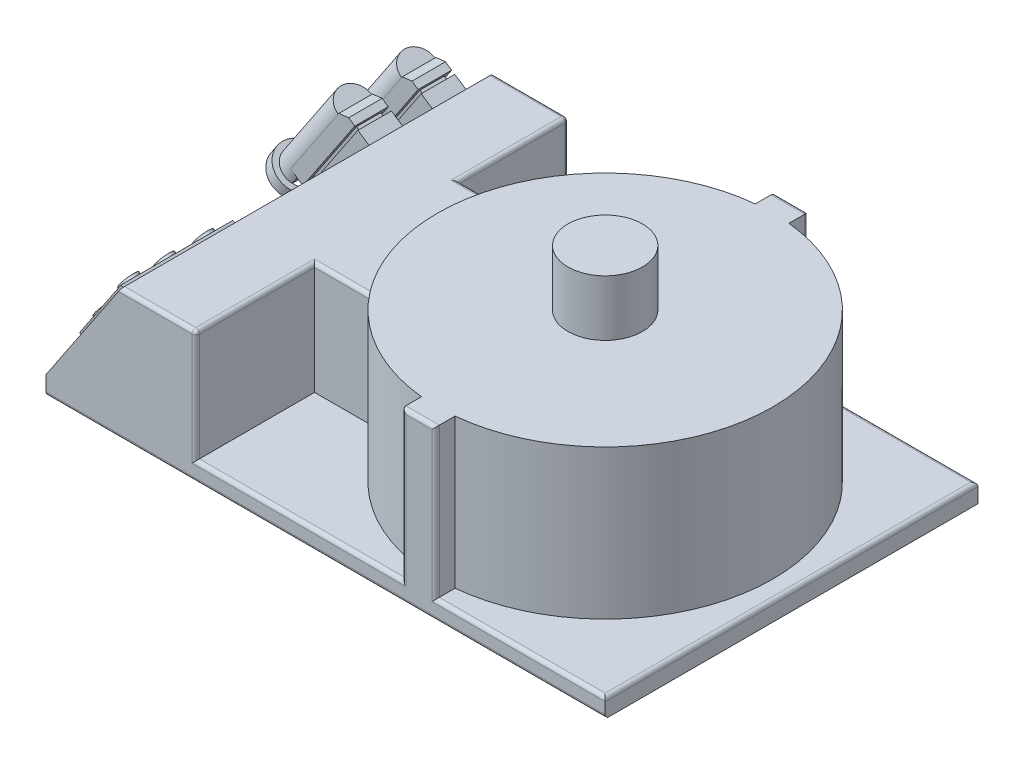
from build123d import *
from build123d.topology import SkipClean

# Parameters (mm, degrees)
SKETCH1_W             = 150
SKETCH1_H             = 100
BOSS_EXTRUDE1_DEPTH   = 5
SKETCH2_R             = 45
BOSS_EXTRUDE2_DEPTH   = 40
SKETCH4_R             = 10
BOSS_EXTRUDE3_DEPTH   = 15
SKETCH5_W             = 9
SKETCH5_H             = 100
BOSS_EXTRUDE5_DEPTH   = 40
SKETCH6_W             = 80.317123649
SKETCH6_H             = 100
BOSS_EXTRUDE8_DEPTH   = 30
CUT_EXTRUDE2_START    = -30
CUT_EXTRUDE2_DEPTH    = 30
CUT_EXTRUDE3_DEPTH    = 111
SKETCH11_W            = 20
SKETCH11_H            = 30
BOSS_EXTRUDE9_DEPTH   = 1
SKETCH12_R            = 2.5
BOSS_EXTRUDE10_DEPTH  = 1
SKETCH13_W            = 25
SKETCH13_H            = 9
BOSS_EXTRUDE11_DEPTH  = 4
SKETCH14_W            = 22.246843074
SKETCH14_H            = 6.498718574
BOSS_EXTRUDE12_DEPTH  = 1
SKETCH15_W            = 25
SKETCH15_H            = 9
BOSS_EXTRUDE13_DEPTH  = 4
CUT_EXTRUDE4_DEPTH    = 13
BOSS_EXTRUDE14_DEPTH  = 23
BOSS_EXTRUDE15_START  = 3
BOSS_EXTRUDE15_DEPTH  = 3
SKETCH19_R            = 6
SKETCH19_R_2          = 4.5
BOSS_EXTRUDE16_DEPTH  = 3
MIRROR3_START         = -32.616927235
MIRROR3_OUTLINE_W     = 4
MIRROR3_OUTLINE_H     = 9
MIRROR3_DEPTH         = 23
MIRROR3_START_2       = -31.240348772
MIRROR3_2_DEPTH       = 22.246843074
MIRROR3_START_3       = -35.616927235
MIRROR3_3_DEPTH       = 3
MIRROR3_START_4       = -8.993505698
MIRROR3_4_OUTLINE_W   = 4
MIRROR3_4_OUTLINE_H   = 9
MIRROR3_4_DEPTH       = 1.376578463
MIRROR3_START_5       = -41
MIRROR3_5_OUTLINE_W   = 2.608428667
MIRROR3_5_OUTLINE_H   = 9
MIRROR3_5_DEPTH       = 2.335246434
SKETCH20_R            = 6
SKETCH20_R_2          = 4.5
BOSS_EXTRUDE17_DEPTH  = 3
FILLET1_R             = 1
FILLET2_R             = 1
BODY_MOVE_COPY1_ANGLE = 90


with BuildPart() as part:
    # Sketch1 → Boss-Extrude1 (new body)
    with BuildSketch(Plane.XY):
        Rectangle(SKETCH1_W, SKETCH1_H)
    extrude(amount=BOSS_EXTRUDE1_DEPTH)

    # Sketch2 → Boss-Extrude2 (add)
    with BuildSketch(Plane(origin=(0, 0, 0), x_dir=(-1, 0, 0), z_dir=(0, 0, -1))):
        with Locations(Location((-25, 0, 0), (0, 0, 180))):
            Circle(SKETCH2_R)
    extrude(amount=BOSS_EXTRUDE2_DEPTH)

    # Sketch4 → Boss-Extrude3 (add)
    with BuildSketch(Plane(origin=(0, 0, -40), x_dir=(-1, 0, 0), z_dir=(0, 0, -1))):
        with Locations((-25, 0)):
            Circle(SKETCH4_R)
    extrude(amount=BOSS_EXTRUDE3_DEPTH)

    # Sketch5 → Boss-Extrude5 (add)
    with BuildSketch(Plane(origin=(0, 0, -40), x_dir=(-1, 0, 0), z_dir=(0, 0, -1))):
        with Locations((-25, 0)):
            Rectangle(SKETCH5_W, SKETCH5_H)
    extrude(amount=-BOSS_EXTRUDE5_DEPTH)

    # Sketch6 → Boss-Extrude8 (add)
    with BuildSketch(Plane(origin=(0, 0, 0), x_dir=(-1, 0, 0), z_dir=(0, 0, -1))):
        with Locations((34.841438176, 0)):
            Rectangle(SKETCH6_W, SKETCH6_H)
    extrude(amount=BOSS_EXTRUDE8_DEPTH)

    # Sketch8 → Cut-Extrude2 (cut)
    with SkipClean():  # the faces are left unmerged after this step: merging them gives an invalid solid
        with BuildSketch(Plane(origin=(0, 0, -30), x_dir=(-1, 0, 0), z_dir=(0, 0, -1)).offset(CUT_EXTRUDE2_START)):
            with BuildLine():
                Line((34.841438175, -50), (34.841438175, -20.46057611))
                Line((34.841438175, -20.46057611), (15.07948135, -20.46057611))
                ThreePointArc((15.07948135, -20.46057611), (6.511107186, -32.125536944), (-5.317123649, -40.467077712))
                Line((-5.317123649, -40.467077712), (-5.317123649, -50))
                Line((-5.317123649, -50), (34.841438175, -50))
            make_face()
            with BuildLine():
                Line((-5.317123649, 50), (-5.317123649, 40.467077712))
                ThreePointArc((-5.317123649, 40.467077712), (7.422035496, 31.205954789), (16.189622203, 18.122224554))
                Line((16.189622203, 18.122224554), (34.841438175, 18.122224554))
                Line((34.841438175, 18.122224554), (34.841438175, 50))
                Line((34.841438175, 50), (-5.317123649, 50))
            make_face()
        extrude(amount=CUT_EXTRUDE2_DEPTH, mode=Mode.SUBTRACT)

    # Sketch9 → Cut-Extrude3 (cut)
    with SkipClean():  # the faces are left unmerged after this step: merging them gives an invalid solid
        with BuildSketch(Plane.XZ.offset(50)):
            Polygon((-75, 0), (-54.920719088, -30), (-75, -30), align=None)
        extrude(amount=-CUT_EXTRUDE3_DEPTH, mode=Mode.SUBTRACT)

    # Sketch11 → Boss-Extrude9 (add)
    with SkipClean():  # the faces are left unmerged after this step: merging them gives an invalid solid
        with BuildSketch(Plane(origin=(-51.796473514, 0, -34.667864732), x_dir=(-0.5562196986319989, 0, 0.8310352861664349), z_dir=(-0.8310352861664349, 0, -0.5562196986319989))):
            with Locations((17.616927235, 33)):
                Rectangle(SKETCH11_W, SKETCH11_H)
        extrude(amount=BOSS_EXTRUDE9_DEPTH)

    # Sketch12 → Boss-Extrude10 (add)
    with SkipClean():  # the faces are left unmerged after this step: merging them gives an invalid solid
        with BuildSketch(Plane(origin=(-52.6275088, 0, -35.22408443), x_dir=(-0.5562196986319992, 0, 0.8310352861664349), z_dir=(-0.8310352861664349, 0, -0.5562196986319992))):
            with Locations((11.616927235, 23)):
                Circle(SKETCH12_R)
            with Locations((11.616927235, 33.468721453)):
                Circle(SKETCH12_R)
            with Locations((11.616927235, 43)):
                Circle(SKETCH12_R)
            with Locations((23.616927235, 23)):
                Circle(SKETCH12_R)
            with Locations((23.616927235, 33.468721453)):
                Circle(SKETCH12_R)
            with Locations((23.616927235, 43)):
                Circle(SKETCH12_R)
        extrude(amount=BOSS_EXTRUDE10_DEPTH)

    # Sketch13 → Boss-Extrude11 (add)
    with SkipClean():  # the faces are left unmerged after this step: merging them gives an invalid solid
        with BuildSketch(Plane(origin=(-51.796473514, 0, -34.667864732), x_dir=(-0.5562196986319989, 0, 0.8310352861664349), z_dir=(-0.8310352861664349, 0, -0.5562196986319989))):
            with Locations((20.116927235, -39.513259665)):
                Rectangle(SKETCH13_W, SKETCH13_H)
        extrude(amount=BOSS_EXTRUDE11_DEPTH)

    # Sketch14 → Boss-Extrude12 (add)
    with SkipClean():  # the faces are left unmerged after this step: merging them gives an invalid solid
        with BuildSketch(Plane(origin=(-55.120614659, 0, -36.892743526), x_dir=(-0.556219698631999, 0, 0.8310352861664349), z_dir=(-0.8310352861664349, 0, -0.556219698631999))):
            with Locations((20.116927235, -39.513259665)):
                Rectangle(SKETCH14_W, SKETCH14_H)
        extrude(amount=BOSS_EXTRUDE12_DEPTH)

    # Sketch15 → Boss-Extrude13 (add)
    with SkipClean():  # the faces are left unmerged after this step: merging them gives an invalid solid
        with BuildSketch(Plane(origin=(-55.951649945, 0, -37.448963225), x_dir=(-0.5562196986319986, 0, 0.8310352861664351), z_dir=(-0.8310352861664351, 0, -0.5562196986319986))):
            with Locations((20.116927235, -39.513259665)):
                Rectangle(SKETCH15_W, SKETCH15_H)
        extrude(amount=BOSS_EXTRUDE13_DEPTH)

    # Sketch16 → Cut-Extrude4 (cut)
    with SkipClean():  # the faces are left unmerged after this step: merging them gives an invalid solid
        with BuildSketch(Plane.XZ.offset(44.013259665)):
            Polygon((-61.850405488, -32.231467318), (-64.443857619, -31.95235057), (-63.51247606, -33.343906715), align=None)
        extrude(amount=-CUT_EXTRUDE4_DEPTH, mode=Mode.SUBTRACT)

    # Sketch17 → Boss-Extrude14 (add)
    with SkipClean():  # the faces are left unmerged after this step: merging them gives an invalid solid
        with BuildSketch(Plane(origin=(-18.142177437, 0, 27.105817458), x_dir=(0.8310352861664351, 0, 0.5562196986319986), z_dir=(-0.5562196986319986, 0, 0.8310352861664351))):
            with BuildLine():
                Line((-69.327646462, -35.482130791), (-69.327646462, -43.544388539))
                ThreePointArc((-69.327646462, -43.544388539), (-75.827646462, -39.513259665), (-69.327646462, -35.482130791))
            make_face()
        extrude(amount=-BOSS_EXTRUDE14_DEPTH)

    # Sketch18 → Boss-Extrude15 (add)
    with SkipClean():  # the faces are left unmerged after this step: merging them gives an invalid solid
        with BuildSketch(Plane(origin=(-18.142177437, 0, 27.105817458), x_dir=(0.8310352861664351, 0, 0.5562196986319986), z_dir=(-0.5562196986319986, 0, 0.8310352861664351)).offset(BOSS_EXTRUDE15_START)):
            with BuildLine():
                Line((-69.327646462, -35.482130791), (-69.327646462, -43.544388539))
                ThreePointArc((-69.327646462, -43.544388539), (-75.827646462, -39.513259665), (-69.327646462, -35.482130791))
            make_face()
        extrude(amount=-BOSS_EXTRUDE15_DEPTH)

    # Mirror3: read off the stored shape, not the designer's step
    # Mirror3 outline → Mirror3 (add)
    with SkipClean():  # the faces are left unmerged after this step: merging them gives an invalid solid
        with BuildSketch(Plane(origin=(0, 0, 0), x_dir=(0.8310352861664349, 0, 0.5562196986319992), z_dir=(0.556219698631999, 0, -0.831035286166435)).offset(MIRROR3_START)):
            with BuildLine():
                Line((-67.327646462, 27.013259665), (-71.327646462, 27.013259665))
                ThreePointArc((-71.327646462, 27.013259665), (-75.827646462, 22.513259665), (-71.327646462, 18.013259665))
                Line((-71.327646462, 18.013259665), (-67.327646462, 18.013259665))
                Line((-67.327646462, 18.013259665), (-67.327646462, 27.013259665))
            make_face()
            with Locations((-64.327646462, 22.513259665)):
                Rectangle(MIRROR3_OUTLINE_W, MIRROR3_OUTLINE_H)
        extrude(amount=MIRROR3_DEPTH)

    # Mirror3 2 outline → Mirror3 2 (add)
    with SkipClean():  # the faces are left unmerged after this step: merging them gives an invalid solid
        with BuildSketch(Plane(origin=(0, 0, 0), x_dir=(0.8310352861664349, 0, 0.5562196986319992), z_dir=(0.556219698631999, 0, -0.831035286166435)).offset(MIRROR3_START_2)):
            Polygon((-71.327646462, 27.013259665), (-71.327646462, 18.013259665), (-67.327646462, 18.013259665), (-67.327646462, 19.263900378), (-66.327646462, 19.263900378), (-66.327646462, 18.013259665), (-62.327646462, 18.013259665), (-62.327646462, 27.013259665), (-66.327646462, 27.013259665), (-66.327646462, 25.762618952), (-67.327646462, 25.762618952), (-67.327646462, 27.013259665), align=None)
        extrude(amount=MIRROR3_2_DEPTH)

    # Mirror3 3 outline → Mirror3 3 (add)
    with SkipClean():  # the faces are left unmerged after this step: merging them gives an invalid solid
        with BuildSketch(Plane(origin=(0, 0, 0), x_dir=(0.8310352861664349, 0, 0.5562196986319992), z_dir=(0.556219698631999, 0, -0.831035286166435)).offset(MIRROR3_START_3)):
            with BuildLine():
                ThreePointArc((-69.327646462, 26.544388539), (-75.827646462, 22.513259665), (-69.327646462, 18.482130791))
                Line((-69.327646462, 18.482130791), (-69.327646462, 26.544388539))
            make_face()
        extrude(amount=MIRROR3_3_DEPTH)

    # Mirror3 4 outline → Mirror3 4 (add)
    with SkipClean():  # the faces are left unmerged after this step: merging them gives an invalid solid
        with BuildSketch(Plane(origin=(0, 0, 0), x_dir=(0.8310352861664349, 0, 0.5562196986319992), z_dir=(0.556219698631999, 0, -0.831035286166435)).offset(MIRROR3_START_4)):
            with Locations((-69.327646462, 22.513259665)):
                Rectangle(MIRROR3_4_OUTLINE_W, MIRROR3_4_OUTLINE_H)
            with Locations((-64.327646462, 22.513259665)):
                Rectangle(MIRROR3_4_OUTLINE_W, MIRROR3_4_OUTLINE_H)
        extrude(amount=MIRROR3_4_DEPTH)

    # Mirror3 5 outline → Mirror3 5 (cut)
    with SkipClean():  # the faces are left unmerged after this step: merging them gives an invalid solid
        with BuildSketch(Plane(origin=(0, 0, 0), x_dir=(0.9942584066298962, 0, -0.10700570473474803), z_dir=(0.10700570473474803, 0, 0.9942584066298962)).offset(MIRROR3_START_5)):
            with Locations((-59.350549069, -22.513259665)):
                Rectangle(MIRROR3_5_OUTLINE_W, MIRROR3_5_OUTLINE_H)
        extrude(amount=MIRROR3_5_DEPTH, mode=Mode.SUBTRACT)

    # Fillet1
    # the kernel refuses this fillet: 1 mm, written as the material it takes off along each edge
    with BuildSketch(Plane(origin=(-35.841438175, -49, -29), x_dir=(1, 0, 0), z_dir=(0, 0, -1))) as fillet1_piece_1_section:
        Polygon((0, 0), (FILLET1_R, 0), (FILLET1_R, FILLET1_R), (0, FILLET1_R), align=None)
    fillet1_piece_1 = extrude(amount=FILLET1_R, mode=Mode.PRIVATE)
    fillet1_piece_1 = fillet1_piece_1 - Plane(origin=(-35.841438175, -49, -29), x_dir=(-0.7071067811865475, 0.7071067811865475, 0), z_dir=(0, 0, -1)) * Sphere(FILLET1_R, mode=Mode.PRIVATE)
    add(fillet1_piece_1, mode=Mode.SUBTRACT)
    with BuildSketch(Plane(origin=(77.5, -50, 0), x_dir=(0, 0, 1), z_dir=(-1, 0, 0)), Plane(origin=(29.5, 50, 0), x_dir=(0, 0, 1), z_dir=(1, 0, 0))) as fillet1_piece_2:
        with BuildLine():
            CenterArc((FILLET1_R, FILLET1_R), FILLET1_R, 180, 90)
            Line((0, FILLET1_R), (0, 0))
            Line((0, 0), (FILLET1_R, 0))
        make_face()
    extrude(amount=48, mode=Mode.SUBTRACT)
    with BuildSketch(Plane(origin=(-34.841438175, 50, 0), x_dir=(0, 0, 1), z_dir=(1, 0, 0)), Plane(origin=(5.317123649, -50, 0), x_dir=(0, 0, 1), z_dir=(-1, 0, 0))) as fillet1_piece_3:
        with BuildLine():
            CenterArc((FILLET1_R, FILLET1_R), FILLET1_R, 180, 90)
            Line((0, FILLET1_R), (0, 0))
            Line((0, 0), (FILLET1_R, 0))
        make_face()
    extrude(amount=40.158561825, mode=Mode.SUBTRACT)
    with BuildSketch(Plane(origin=(20.5, 50, -42.5), x_dir=(1, 0, 0), z_dir=(0, 0, 1)), Plane(origin=(29.5, -50, -42.5), x_dir=(-1, 0, 0), z_dir=(0, 0, 1))) as fillet1_piece_4:
        with BuildLine():
            CenterArc((FILLET1_R, -FILLET1_R), FILLET1_R, 90, 90)
            Line((0, -FILLET1_R), (0, 0))
            Line((0, 0), (FILLET1_R, 0))
        make_face()
    extrude(amount=42.5, mode=Mode.SUBTRACT)
    with BuildSketch(Plane(origin=(32, 50, -40), x_dir=(0, 0, 1), z_dir=(-1, 0, 0)), Plane(origin=(18, -50, -40), x_dir=(0, 0, 1), z_dir=(1, 0, 0))) as fillet1_piece_5:
        with BuildLine():
            CenterArc((FILLET1_R, -FILLET1_R), FILLET1_R, 90, 90)
            Line((0, -FILLET1_R), (0, 0))
            Line((0, 0), (FILLET1_R, 0))
        make_face()
    extrude(amount=14, mode=Mode.SUBTRACT)
    with BuildSketch(Plane(origin=(20.5, -50, -42.5), x_dir=(1, 0, 0), z_dir=(0, 0, 1)), Plane(origin=(29.5, 50, -42.5), x_dir=(-1, 0, 0), z_dir=(0, 0, 1))) as fillet1_piece_6:
        with BuildLine():
            CenterArc((FILLET1_R, FILLET1_R), FILLET1_R, 180, 90)
            Line((0, FILLET1_R), (0, 0))
            Line((0, 0), (FILLET1_R, 0))
        make_face()
    extrude(amount=42.5, mode=Mode.SUBTRACT)
    with BuildSketch(Plane(origin=(75, 52.5, 0), x_dir=(-1, 0, 0), z_dir=(0, -1, 0))) as fillet1_piece_7:
        with BuildLine():
            CenterArc((FILLET1_R, -FILLET1_R), FILLET1_R, 90, 90)
            Line((0, -FILLET1_R), (0, 0))
            Line((0, 0), (FILLET1_R, 0))
        make_face()
    extrude(amount=105, mode=Mode.SUBTRACT)
    with BuildSketch(Plane(origin=(-77.5, 50, 5), x_dir=(0, 0, -1), z_dir=(1, 0, 0))) as fillet1_piece_8:
        with BuildLine():
            CenterArc((FILLET1_R, -FILLET1_R), FILLET1_R, 90, 90)
            Line((0, -FILLET1_R), (0, 0))
            Line((0, 0), (FILLET1_R, 0))
        make_face()
    extrude(amount=155, mode=Mode.SUBTRACT)
    with BuildSketch(Plane(origin=(-57.420719088, -50, -30), x_dir=(0, 0, 1), z_dir=(1, 0, 0))) as fillet1_piece_9:
        with BuildLine():
            CenterArc((FILLET1_R, -FILLET1_R), FILLET1_R, 90, 90)
            Line((0, -FILLET1_R), (0, 0))
            Line((0, 0), (FILLET1_R, 0))
        make_face()
    extrude(amount=21.579280912, mode=Mode.SUBTRACT)
    with BuildSketch(Plane(origin=(-34.841438175, -50, 0), x_dir=(-1, 0, 0), z_dir=(0, 0, -1))) as fillet1_piece_10:
        with BuildLine():
            CenterArc((FILLET1_R, FILLET1_R), FILLET1_R, 180, 90)
            Line((0, FILLET1_R), (0, 0))
            Line((0, 0), (FILLET1_R, 0))
        make_face()
    extrude(amount=29, mode=Mode.SUBTRACT)
    with BuildSketch(Plane(origin=(-34.841438175, -49, -30), x_dir=(-1, 0, 0), z_dir=(0, 1, 0))) as fillet1_piece_11:
        with BuildLine():
            CenterArc((FILLET1_R, FILLET1_R), FILLET1_R, 180, 90)
            Line((0, FILLET1_R), (0, 0))
            Line((0, 0), (FILLET1_R, 0))
        make_face()
    extrude(amount=28.53942389, mode=Mode.SUBTRACT)
    with BuildSketch(Plane(origin=(-34.841438175, -20.46057611, -30), x_dir=(0, 1, 0), z_dir=(1, 0, 0))) as fillet1_piece_12_section:
        with BuildLine():
            CenterArc((FILLET1_R, FILLET1_R), FILLET1_R, 180, 90)
            Line((0, FILLET1_R), (0, 0))
            Line((0, 0), (FILLET1_R, 0))
        make_face()
    fillet1_piece_12 = extrude(amount=22.261956826, mode=Mode.PRIVATE)
    fillet1_piece_12 = fillet1_piece_12 - Plane(origin=(25, 0, -30), x_dir=(1, 0, 0), z_dir=(0, 0, 1)) * Cylinder(45, 49, mode=Mode.PRIVATE)
    add(fillet1_piece_12, mode=Mode.SUBTRACT)
    with BuildSketch(Plane(origin=(-13.689622203, 18.122224554, -30), x_dir=(0, -1, 0), z_dir=(-1, 0, 0))) as fillet1_piece_13_section:
        with BuildLine():
            CenterArc((FILLET1_R, FILLET1_R), FILLET1_R, 180, 90)
            Line((0, FILLET1_R), (0, 0))
            Line((0, 0), (FILLET1_R, 0))
        make_face()
    fillet1_piece_13 = extrude(amount=21.151815973, mode=Mode.PRIVATE)
    fillet1_piece_13 = fillet1_piece_13 - Plane(origin=(25, 0, -30), x_dir=(1, 0, 0), z_dir=(0, 0, 1)) * Cylinder(45, 47, mode=Mode.PRIVATE)
    add(fillet1_piece_13, mode=Mode.SUBTRACT)
    with BuildSketch(Plane(origin=(-34.841438175, 18.122224554, -30), x_dir=(-1, 0, 0), z_dir=(0, 1, 0))) as fillet1_piece_14:
        with BuildLine():
            CenterArc((FILLET1_R, FILLET1_R), FILLET1_R, 180, 90)
            Line((0, FILLET1_R), (0, 0))
            Line((0, 0), (FILLET1_R, 0))
        make_face()
    extrude(amount=34.377775446, mode=Mode.SUBTRACT)
    with BuildSketch(Plane(origin=(20.5, -50, 0), x_dir=(0, 0, 1), z_dir=(-1, 0, 0)), Plane(origin=(5.317123649, 50, 0), x_dir=(0, 0, 1), z_dir=(1, 0, 0))) as fillet1_piece_15:
        with BuildLine():
            CenterArc((FILLET1_R, FILLET1_R), FILLET1_R, 180, 90)
            Line((0, FILLET1_R), (0, 0))
            Line((0, 0), (FILLET1_R, 0))
        make_face()
    extrude(amount=15.182876351, mode=Mode.SUBTRACT)
    with BuildSketch(Plane(origin=(77.5, -50, 0), x_dir=(0, 0, 1), z_dir=(-1, 0, 0))) as fillet1_piece_16a_section:
        with BuildLine():
            CenterArc((FILLET1_R, FILLET1_R), FILLET1_R, 180, 90)
            Line((0, FILLET1_R), (0, 0))
            Line((0, 0), (FILLET1_R, 0))
        make_face()
    fillet1_piece_16a = extrude(amount=50.5, mode=Mode.PRIVATE)
    fillet1_piece_16a = split(fillet1_piece_16a, bisect_by=Plane(origin=(29.5, -50, 0), z_dir=(-1, 0, 0)), keep=Keep.TOP, mode=Mode.PRIVATE)
    with BuildSketch(Plane(origin=(29.5, -50, -42.5), x_dir=(-1, 0, 0), z_dir=(0, 0, 1))) as fillet1_piece_16b_section:
        with BuildLine():
            CenterArc((FILLET1_R, -FILLET1_R), FILLET1_R, 90, 90)
            Line((0, -FILLET1_R), (0, 0))
            Line((0, 0), (FILLET1_R, 0))
        make_face()
    fillet1_piece_16b = extrude(amount=45, mode=Mode.PRIVATE)
    fillet1_piece_16b = split(fillet1_piece_16b, bisect_by=Plane(origin=(29.5, -50, 0), z_dir=(0, 0, 1)), keep=Keep.TOP, mode=Mode.PRIVATE)
    fillet1_piece_16 = fillet1_piece_16a & fillet1_piece_16b
    add(fillet1_piece_16, mode=Mode.SUBTRACT)
    with BuildSketch(Plane(origin=(5.317123649, 50, 0), x_dir=(0, 0, 1), z_dir=(1, 0, 0))) as fillet1_piece_17a_section:
        with BuildLine():
            CenterArc((FILLET1_R, FILLET1_R), FILLET1_R, 180, 90)
            Line((0, FILLET1_R), (0, 0))
            Line((0, 0), (FILLET1_R, 0))
        make_face()
    fillet1_piece_17a = extrude(amount=17.682876351, mode=Mode.PRIVATE)
    fillet1_piece_17a = split(fillet1_piece_17a, bisect_by=Plane(origin=(20.5, 50, 0), z_dir=(1, 0, 0)), keep=Keep.TOP, mode=Mode.PRIVATE)
    with BuildSketch(Plane(origin=(20.5, 50, -42.5), x_dir=(1, 0, 0), z_dir=(0, 0, 1))) as fillet1_piece_17b_section:
        with BuildLine():
            CenterArc((FILLET1_R, -FILLET1_R), FILLET1_R, 90, 90)
            Line((0, -FILLET1_R), (0, 0))
            Line((0, 0), (FILLET1_R, 0))
        make_face()
    fillet1_piece_17b = extrude(amount=45, mode=Mode.PRIVATE)
    fillet1_piece_17b = split(fillet1_piece_17b, bisect_by=Plane(origin=(20.5, 50, 0), z_dir=(0, 0, 1)), keep=Keep.TOP, mode=Mode.PRIVATE)
    fillet1_piece_17 = fillet1_piece_17a & fillet1_piece_17b
    add(fillet1_piece_17, mode=Mode.SUBTRACT)
    with BuildSketch(Plane(origin=(20.5, -50, -42.5), x_dir=(1, 0, 0), z_dir=(0, 0, 1))) as fillet1_piece_18a_section:
        with BuildLine():
            CenterArc((FILLET1_R, FILLET1_R), FILLET1_R, 180, 90)
            Line((0, FILLET1_R), (0, 0))
            Line((0, 0), (FILLET1_R, 0))
        make_face()
    fillet1_piece_18a = extrude(amount=45, mode=Mode.PRIVATE)
    fillet1_piece_18a = split(fillet1_piece_18a, bisect_by=Plane(origin=(20.5, -50, 0), z_dir=(0, 0, 1)), keep=Keep.TOP, mode=Mode.PRIVATE)
    with BuildSketch(Plane(origin=(23, -50, 0), x_dir=(0, 0, 1), z_dir=(-1, 0, 0))) as fillet1_piece_18b_section:
        with BuildLine():
            CenterArc((FILLET1_R, FILLET1_R), FILLET1_R, 180, 90)
            Line((0, FILLET1_R), (0, 0))
            Line((0, 0), (FILLET1_R, 0))
        make_face()
    fillet1_piece_18b = extrude(amount=17.682876351, mode=Mode.PRIVATE)
    fillet1_piece_18b = split(fillet1_piece_18b, bisect_by=Plane(origin=(20.5, -50, 0), z_dir=(1, 0, 0)), keep=Keep.TOP, mode=Mode.PRIVATE)
    fillet1_piece_18 = fillet1_piece_18a & fillet1_piece_18b
    add(fillet1_piece_18, mode=Mode.SUBTRACT)
    with BuildSketch(Plane(origin=(29.5, 50, -42.5), x_dir=(-1, 0, 0), z_dir=(0, 0, 1))) as fillet1_piece_19a_section:
        with BuildLine():
            CenterArc((FILLET1_R, FILLET1_R), FILLET1_R, 180, 90)
            Line((0, FILLET1_R), (0, 0))
            Line((0, 0), (FILLET1_R, 0))
        make_face()
    fillet1_piece_19a = extrude(amount=45, mode=Mode.PRIVATE)
    fillet1_piece_19a = split(fillet1_piece_19a, bisect_by=Plane(origin=(29.5, 50, 0), z_dir=(0, 0, 1)), keep=Keep.TOP, mode=Mode.PRIVATE)
    with BuildSketch(Plane(origin=(27, 50, 0), x_dir=(0, 0, 1), z_dir=(1, 0, 0))) as fillet1_piece_19b_section:
        with BuildLine():
            CenterArc((FILLET1_R, FILLET1_R), FILLET1_R, 180, 90)
            Line((0, FILLET1_R), (0, 0))
            Line((0, 0), (FILLET1_R, 0))
        make_face()
    fillet1_piece_19b = extrude(amount=50.5, mode=Mode.PRIVATE)
    fillet1_piece_19b = split(fillet1_piece_19b, bisect_by=Plane(origin=(29.5, 50, 0), z_dir=(-1, 0, 0)), keep=Keep.TOP, mode=Mode.PRIVATE)
    fillet1_piece_19 = fillet1_piece_19a & fillet1_piece_19b
    add(fillet1_piece_19, mode=Mode.SUBTRACT)
    with BuildSketch(Plane(origin=(5.317123649, -50, 0), x_dir=(0, 0, 1), z_dir=(-1, 0, 0))) as fillet1_piece_20a_section:
        with BuildLine():
            CenterArc((FILLET1_R, FILLET1_R), FILLET1_R, 180, 90)
            Line((0, FILLET1_R), (0, 0))
            Line((0, 0), (FILLET1_R, 0))
        make_face()
    fillet1_piece_20a = extrude(amount=42.658561825, mode=Mode.PRIVATE)
    fillet1_piece_20a = split(fillet1_piece_20a, bisect_by=Plane(origin=(-34.841438175, -50, 0), z_dir=(-1, 0, 0)), keep=Keep.TOP, mode=Mode.PRIVATE)
    with BuildSketch(Plane(origin=(-34.841438175, -50, 2.5), x_dir=(-1, 0, 0), z_dir=(0, 0, -1))) as fillet1_piece_20b_section:
        with BuildLine():
            CenterArc((FILLET1_R, FILLET1_R), FILLET1_R, 180, 90)
            Line((0, FILLET1_R), (0, 0))
            Line((0, 0), (FILLET1_R, 0))
        make_face()
    fillet1_piece_20b = extrude(amount=31.5, mode=Mode.PRIVATE)
    fillet1_piece_20b = split(fillet1_piece_20b, bisect_by=Plane(origin=(-34.841438175, -50, 0), z_dir=(0, 0, 1)), keep=Keep.TOP, mode=Mode.PRIVATE)
    fillet1_piece_20 = fillet1_piece_20a & fillet1_piece_20b
    add(fillet1_piece_20, mode=Mode.SUBTRACT)
    with BuildSketch(Plane(origin=(-37.341438175, -20.46057611, -30), x_dir=(0, 1, 0), z_dir=(1, 0, 0))) as fillet1_piece_21a_section:
        with BuildLine():
            CenterArc((FILLET1_R, FILLET1_R), FILLET1_R, 180, 90)
            Line((0, FILLET1_R), (0, 0))
            Line((0, 0), (FILLET1_R, 0))
        make_face()
    fillet1_piece_21a = extrude(amount=24.761956826, mode=Mode.PRIVATE)
    fillet1_piece_21a = split(fillet1_piece_21a, bisect_by=Plane(origin=(-34.841438175, -20.46057611, -30), z_dir=(-1, 0, 0)), keep=Keep.TOP, mode=Mode.PRIVATE)
    with BuildSketch(Plane(origin=(-34.841438175, -49, -30), x_dir=(-1, 0, 0), z_dir=(0, 1, 0))) as fillet1_piece_21b_section:
        with BuildLine():
            CenterArc((FILLET1_R, FILLET1_R), FILLET1_R, 180, 90)
            Line((0, FILLET1_R), (0, 0))
            Line((0, 0), (FILLET1_R, 0))
        make_face()
    fillet1_piece_21b = extrude(amount=31.03942389, mode=Mode.PRIVATE)
    fillet1_piece_21b = split(fillet1_piece_21b, bisect_by=Plane(origin=(-34.841438175, -20.46057611, -30), z_dir=(0, 1, 0)), keep=Keep.TOP, mode=Mode.PRIVATE)
    fillet1_piece_21 = fillet1_piece_21a & fillet1_piece_21b
    add(fillet1_piece_21, mode=Mode.SUBTRACT)
    with BuildSketch(Plane(origin=(-34.841438175, 15.622224554, -30), x_dir=(-1, 0, 0), z_dir=(0, 1, 0))) as fillet1_piece_22a_section:
        with BuildLine():
            CenterArc((FILLET1_R, FILLET1_R), FILLET1_R, 180, 90)
            Line((0, FILLET1_R), (0, 0))
            Line((0, 0), (FILLET1_R, 0))
        make_face()
    fillet1_piece_22a = extrude(amount=36.877775446, mode=Mode.PRIVATE)
    fillet1_piece_22a = split(fillet1_piece_22a, bisect_by=Plane(origin=(-34.841438175, 18.122224554, -30), z_dir=(0, -1, 0)), keep=Keep.TOP, mode=Mode.PRIVATE)
    with BuildSketch(Plane(origin=(-13.689622203, 18.122224554, -30), x_dir=(0, -1, 0), z_dir=(-1, 0, 0))) as fillet1_piece_22b_section:
        with BuildLine():
            CenterArc((FILLET1_R, FILLET1_R), FILLET1_R, 180, 90)
            Line((0, FILLET1_R), (0, 0))
            Line((0, 0), (FILLET1_R, 0))
        make_face()
    fillet1_piece_22b = extrude(amount=23.651815973, mode=Mode.PRIVATE)
    fillet1_piece_22b = split(fillet1_piece_22b, bisect_by=Plane(origin=(-34.841438175, 18.122224554, -30), z_dir=(-1, 0, 0)), keep=Keep.TOP, mode=Mode.PRIVATE)
    fillet1_piece_22 = fillet1_piece_22a & fillet1_piece_22b
    add(fillet1_piece_22, mode=Mode.SUBTRACT)

    # Fillet2
    fillet2_edges = [part.edges().sort_by_distance(p)[0] for p in [
        (-45.381078632, 50, -30),
        (-35.134331394, 50, -29.707106781),
        (-34.841438175, 50, -14),
    ]]
    fillet(fillet2_edges, radius=FILLET2_R)


with BuildPart() as body_2:
    # Sketch19 → Boss-Extrude16 (new body)
    with BuildSketch(Plane(origin=(-19.810836533, 0, 29.598923317), x_dir=(0.8310352861664351, 0, 0.5562196986319986), z_dir=(-0.5562196986319986, 0, 0.8310352861664351))):
        with Locations((-71.327646462, -39.513259665)):
            Circle(SKETCH19_R)
        with Locations((-71.327646462, -39.513259665)):
            Circle(SKETCH19_R_2, mode=Mode.SUBTRACT)
    extrude(amount=BOSS_EXTRUDE16_DEPTH)


with BuildPart() as body_3:
    # Sketch20 → Boss-Extrude17 (new body)
    with BuildSketch(Plane(origin=(-19.810836533, 0, 29.598923317), x_dir=(0.8310352861664351, 0, 0.5562196986319986), z_dir=(-0.5562196986319986, 0, 0.8310352861664351))):
        with Locations((-71.327646462, -22.513259665)):
            Circle(SKETCH20_R)
        with Locations((-71.327646462, -22.513259665)):
            Circle(SKETCH20_R_2, mode=Mode.SUBTRACT)
    extrude(amount=BOSS_EXTRUDE17_DEPTH)


with BuildPart() as part_1:
    # Body-Move/Copy1: moved
    add(part.part.rotate(Axis((0, 0, 0), (1, 0, 0)), BODY_MOVE_COPY1_ANGLE))


with BuildPart() as body_2_1:
    # Body-Move/Copy1: moved
    add(body_2.part.rotate(Axis((0, 0, 0), (1, 0, 0)), BODY_MOVE_COPY1_ANGLE))


with BuildPart() as body_3_1:
    # Body-Move/Copy1: moved
    add(body_3.part.rotate(Axis((0, 0, 0), (1, 0, 0)), BODY_MOVE_COPY1_ANGLE))


solid = Compound([part_1.part, body_2_1.part, body_3_1.part])
